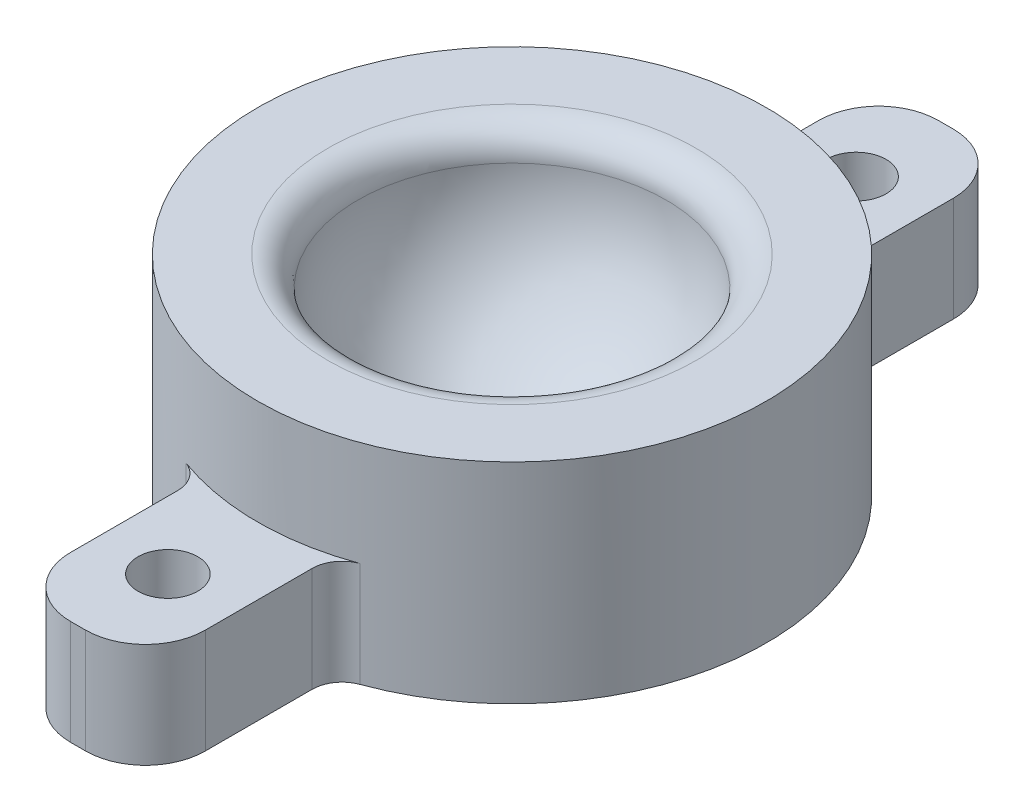
from build123d import *

# Parameters (mm, degrees)
CROQUIS1_R              = 1
CROQUIS1_R_2            = 8.5
SALIENTE_EXTRUIR1_DEPTH = 3.5
CROQUIS1_3_R            = 8.5
SALIENTE_EXTRUIR2_DEPTH = 7
REDONDEO1_R             = 1
REDONDEO3_R             = 1


with BuildPart() as part:
    # Croquis1 → Saliente-Extruir1 (new body)
    # profile 1 of 3: a face of its own
    with BuildSketch(Plane(origin=(0, 0, 0), x_dir=(1, 0, 0), z_dir=(0, 1, 0))):
        with BuildLine():
            Line((-2.25, 12.5), (-2.25, 8.196798155))
            ThreePointArc((-2.25, 8.196798155), (0, 8.5), (2.25, 8.196798155))
            Line((2.25, 8.196798155), (2.25, 12.5))
            ThreePointArc((2.25, 12.5), (1.664213562, 13.914213562), (0.25, 14.5))
            Line((0.25, 14.5), (-0.25, 14.5))
            ThreePointArc((-0.25, 14.5), (-1.664213562, 13.914213562), (-2.25, 12.5))
        make_face()
        with Locations(Location((0, 11.5, 0), (0, 0, 270))):
            Circle(CROQUIS1_R, mode=Mode.SUBTRACT)
    # profile 2 of 3: a face of its own
    with BuildSketch(Plane(origin=(0, 0, 0), x_dir=(1, 0, 0), z_dir=(0, 1, 0))):
        Circle(CROQUIS1_R_2)
    # profile 3 of 3: a face of its own
    with BuildSketch(Plane(origin=(0, 0, 0), x_dir=(1, 0, 0), z_dir=(0, 1, 0))):
        with BuildLine():
            ThreePointArc((2.25, -8.196798155), (0, -8.5), (-2.25, -8.196798155))
            Line((-2.25, -8.196798155), (-2.25, -12.5))
            ThreePointArc((-2.25, -12.5), (-1.664213562, -13.914213562), (-0.25, -14.5))
            Line((-0.25, -14.5), (0.25, -14.5))
            ThreePointArc((0.25, -14.5), (1.664213562, -13.914213562), (2.25, -12.5))
            Line((2.25, -12.5), (2.25, -8.196798155))
        make_face()
        with Locations(Location((0, -11.5, 0), (0, 0, 270))):
            Circle(CROQUIS1_R, mode=Mode.SUBTRACT)
    extrude(amount=SALIENTE_EXTRUIR1_DEPTH)

    # Croquis1<3> → Saliente-Extruir2 (add)
    with BuildSketch(Plane(origin=(0, 0, 0), x_dir=(1, 0, 0), z_dir=(0, 1, 0))):
        with Locations(Location((0, 0, 0), (0, 0, 74.650522983))):
            Circle(CROQUIS1_3_R)
    extrude(amount=SALIENTE_EXTRUIR2_DEPTH)

    # Redondeo1
    # the kernel refuses this fillet: 1 mm, written as the material it adds along each edge
    with BuildSketch(Plane(origin=(2.25, 0, -8.196798155), x_dir=(0.9527816834401653, 0, 0.3036561603210522), z_dir=(0, 1, 0)), Plane(origin=(-2.25, 0, 8.196798155), x_dir=(-0.9527816834401646, 0, -0.3036561603210549), z_dir=(0, 1, 0))) as redondeo1_piece_1:
        with BuildLine():
            CenterArc((0.731116518, 0.999174765), REDONDEO1_R, 197.677333553, 69.994809912)
            Line((-0.221665165, 0.695518605), (0, 0))
            ThreePointArc((0, 0), (0.345249467, 0.007014494), (0.690498934, 0))
        make_face()
    extrude(amount=3.5)
    with BuildSketch(Plane(origin=(2.25, 0, 8.196798155), x_dir=(0.9527816834401651, 0, -0.3036561603210529), z_dir=(0, 1, 0)), Plane(origin=(-2.25, 0, -8.196798155), x_dir=(-0.9527816834401648, 0, 0.30365616032105397), z_dir=(0, 1, 0))) as redondeo1_piece_2:
        with BuildLine():
            CenterArc((0.731116518, -0.999174765), REDONDEO1_R, 92.327856536, 69.994809912)
            Line((-0.221665165, -0.695518605), (0, 0))
            ThreePointArc((0, 0), (0.345249467, -0.007014494), (0.690498934, 0))
        make_face()
    extrude(amount=3.5)

    # Croquis2 → Cortar-Revolución1 (revolve, cut)
    with BuildSketch(Plane.XY):
        with BuildLine():
            Line((0, 11.15), (0, 0.85))
            ThreePointArc((0, 0.85), (-5.15, 6), (0, 11.15))
        make_face()
    revolve(axis=Axis((0, 11.15, 0), (0, -1, 0)), mode=Mode.SUBTRACT)

    # Redondeo3
    redondeo3_edges = [part.edges().sort_by_distance(p)[0] for p in [
        (5.05197981, 7, 0),
    ]]
    fillet(redondeo3_edges, radius=REDONDEO3_R)


solid = part.part
